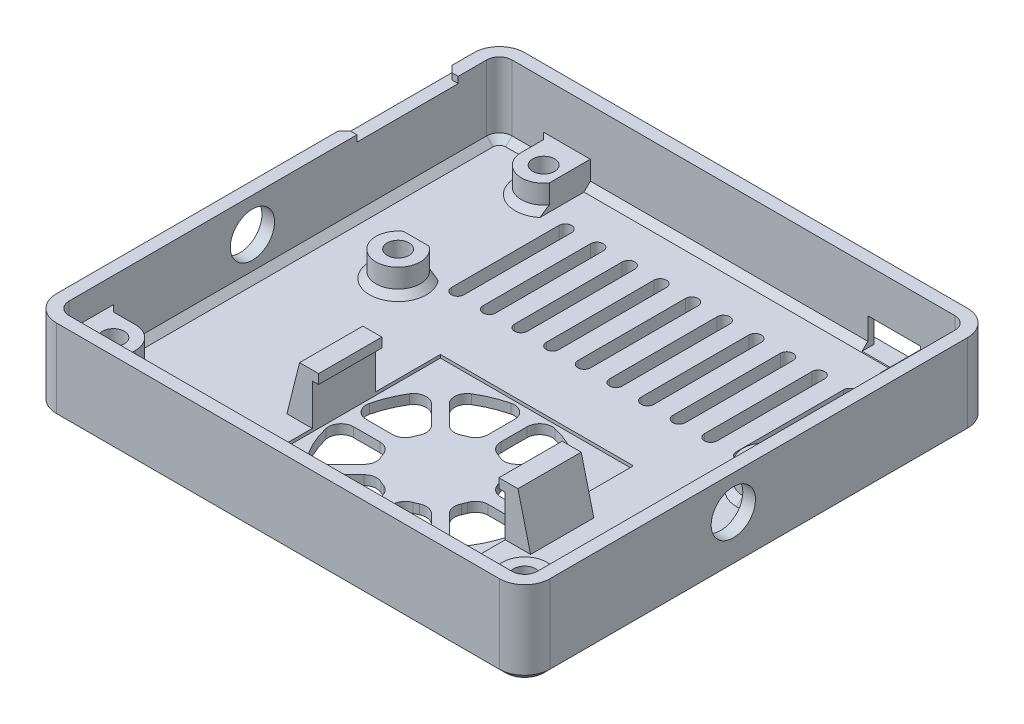
from build123d import *

# Parameters (mm, degrees)
BOSS_EXTRUDE1_DEPTH                               = 13.4
BOSS_EXTRUDE2_DEPTH                               = 2
BOSS_EXTRUDE3_DEPTH                               = 4
CSK_FOR_4_FLAT_HEAD_SOCKET_CAP_SCREW1_D           = 3.4544
CSK_FOR_4_FLAT_HEAD_SOCKET_CAP_SCREW1_CSINK_D     = 6.7237102
CSK_FOR_4_FLAT_HEAD_SOCKET_CAP_SCREW1_CSINK_ANGLE = 82
CUT_EXTRUDE1_REACH                                = 108.647
SKETCH7_W                                         = 8.3
SKETCH7_H                                         = 4.4
BOSS_EXTRUDE4_DEPTH                               = 7.4
CSK_FOR_4_FLAT_HEAD_SOCKET_CAP_SCREW2_D           = 3.4544
CSK_FOR_4_FLAT_HEAD_SOCKET_CAP_SCREW2_CSINK_D     = 6.7237102
CSK_FOR_4_FLAT_HEAD_SOCKET_CAP_SCREW2_CSINK_ANGLE = 82
CHAMFER1_SIZE                                     = 1
CHAMFER2_SIZE                                     = 1
CHAMFER3_SIZE                                     = 1
CHAMFER4_SIZE                                     = 1
CUT_EXTRUDE2_REACH                                = 97.86
SKETCH13_W                                        = 30.5
SKETCH13_H                                        = 30.5
CUT_EXTRUDE3_DEPTH                                = 0.5
SKETCH14_W                                        = 2
SKETCH14_H                                        = 10
BOSS_EXTRUDE5_DEPTH                               = 8
SKETCH15_W                                        = 10
SKETCH15_H                                        = 1.5
BOSS_EXTRUDE6_DEPTH                               = 1
SKETCH16_W                                        = 10
SKETCH16_H                                        = 1.5
BOSS_EXTRUDE7_DEPTH                               = 1
CHAMFER5_SIZE                                     = 2
CHAMFER5_SIZE_2                                   = 8.021561867
CUT_EXTRUDE4_DEPTH                                = 96.661387058
CUT_EXTRUDE5_DEPTH                                = 97.161962556
CUT_EXTRUDE5_DEPTH_BACK                           = 97.161962556
SKETCH18_R                                        = 3.5
CUT_EXTRUDE6_REACH                                = 99.75
SKETCH19_W                                        = 16
SKETCH19_H                                        = 1
CHAMFER6_SIZE                                     = 1


with BuildPart() as part:
    # Sketch2 → Boss-Extrude1 (new body)
    with BuildSketch(Plane(origin=(0, 0, 0), x_dir=(1, 0, 0), z_dir=(0, 1, 0))):
        with BuildLine():
            Line((-75.616981764, 12.627854819), (-75.616981764, -53.372145181))
            ThreePointArc((-75.616981764, -53.372145181), (-74.445408889, -56.200572306), (-71.616981764, -57.372145181))
            Line((-71.616981764, -57.372145181), (-1.616981764, -57.372145181))
            ThreePointArc((-1.616981764, -57.372145181), (1.211445361, -56.200572306), (2.383018236, -53.372145181))
            Line((2.383018236, -53.372145181), (2.383018236, 12.627854819))
            ThreePointArc((2.383018236, 12.627854819), (1.211445361, 15.456281944), (-1.616981764, 16.627854819))
            Line((-1.616981764, 16.627854819), (-71.616981764, 16.627854819))
            ThreePointArc((-71.616981764, 16.627854819), (-74.445408889, 15.456281944), (-75.616981764, 12.627854819))
        make_face()
        with BuildLine():
            Line((-73.616981764, 12.627854819), (-73.616981764, -53.372145181))
            ThreePointArc((-73.616981764, -53.372145181), (-73.031195326, -54.786358744), (-71.616981764, -55.372145181))
            Line((-71.616981764, -55.372145181), (-1.616981764, -55.372145181))
            ThreePointArc((-1.616981764, -55.372145181), (-0.202768202, -54.786358744), (0.383018236, -53.372145181))
            Line((0.383018236, -53.372145181), (0.383018236, 12.627854819))
            ThreePointArc((0.383018236, 12.627854819), (-0.202768202, 14.042068381), (-1.616981764, 14.627854819))
            Line((-1.616981764, 14.627854819), (-71.616981764, 14.627854819))
            ThreePointArc((-71.616981764, 14.627854819), (-73.031195326, 14.042068381), (-73.616981764, 12.627854819))
        make_face(mode=Mode.SUBTRACT)
    extrude(amount=BOSS_EXTRUDE1_DEPTH)

    # Sketch2<3> → Boss-Extrude2 (add)
    with BuildSketch(Plane(origin=(0, 0, 0), x_dir=(1, 0, 0), z_dir=(0, 1, 0))):
        with BuildLine():
            Line((-71.616981764, 14.627854819), (-1.616981764, 14.627854819))
            ThreePointArc((-1.616981764, 14.627854819), (-0.202768202, 14.042068381), (0.383018236, 12.627854819))
            Line((0.383018236, 12.627854819), (0.383018236, -53.372145181))
            ThreePointArc((0.383018236, -53.372145181), (-0.202768202, -54.786358744), (-1.616981764, -55.372145181))
            Line((-1.616981764, -55.372145181), (-71.616981764, -55.372145181))
            ThreePointArc((-71.616981764, -55.372145181), (-73.031195326, -54.786358744), (-73.616981764, -53.372145181))
            Line((-73.616981764, -53.372145181), (-73.616981764, 12.627854819))
            ThreePointArc((-73.616981764, 12.627854819), (-73.031195326, 14.042068381), (-71.616981764, 14.627854819))
        make_face()
    extrude(amount=BOSS_EXTRUDE2_DEPTH)

    # Sketch4 → Boss-Extrude3 (add)
    with BuildSketch(Plane(origin=(0, 2, 0), x_dir=(1, 0, 0), z_dir=(0, 1, 0))):
        with BuildLine():
            Line((-59.234341769, 14.627854819), (-59.234341769, 8.142814098))
            ThreePointArc((-59.234341769, 8.142814098), (-63.156395065, 6.785756677), (-65.616981764, 10.127854819))
            Line((-65.616981764, 10.127854819), (-65.616981764, 14.627854819))
            Line((-65.616981764, 14.627854819), (-59.234341769, 14.627854819))
        make_face()
        with BuildLine():
            Line((-4.116981764, 6.627854819), (0.383018236, 6.627854819))
            Line((0.383018236, 6.627854819), (0.383018236, 12.627854819))
            ThreePointArc((0.383018236, 12.627854819), (-0.202768202, 14.042068381), (-1.616981764, 14.627854819))
            Line((-1.616981764, 14.627854819), (-7.082532008, 14.627854819))
            Line((-7.082532008, 14.627854819), (-7.082532008, 8.268954136))
            ThreePointArc((-7.082532008, 8.268954136), (-5.811656897, 7.065490341), (-4.116981764, 6.627854819))
        make_face()
        with BuildLine():
            Line((-4.116981764, -9.372145181), (0.383018236, -9.372145181))
            Line((0.383018236, -9.372145181), (0.383018236, -16.372145181))
            Line((0.383018236, -16.372145181), (-4.116981764, -16.372145181))
            ThreePointArc((-4.116981764, -16.372145181), (-7.616981764, -12.872145181), (-4.116981764, -9.372145181))
        make_face()
        with BuildLine():
            Line((-64.139653984, -10.015784368), (-60.094309544, -10.015784368))
            ThreePointArc((-60.094309544, -10.015784368), (-62.116981764, -16.372145181), (-64.139653984, -10.015784368))
        make_face()
    extrude(amount=BOSS_EXTRUDE3_DEPTH)

    # CSK for #4 Flat Head Socket Cap Screw1 (through all)
    with Locations(Plane(origin=(0, 0, 0), x_dir=(-1, 0, 0), z_dir=(0, -1, 0))):
        with Locations((4.116981764, 10.127854819), (62.116981764, 10.127854819), (4.116981764, -12.872145181), (62.116981764, -12.872145181)):
            CounterSinkHole(CSK_FOR_4_FLAT_HEAD_SOCKET_CAP_SCREW1_D / 2, CSK_FOR_4_FLAT_HEAD_SOCKET_CAP_SCREW1_CSINK_D / 2, counter_sink_angle=CSK_FOR_4_FLAT_HEAD_SOCKET_CAP_SCREW1_CSINK_ANGLE)

    # Sketch7 → Cut-Extrude1 (cut, up to next)
    with BuildSketch(Plane(origin=(0, 0, -16.627854819), x_dir=(-1, 0, 0), z_dir=(0, 0, -1)), mode=Mode.PRIVATE) as cut_extrude1_sk1:
        with Locations((11.232532008, 4.3)):
            Rectangle(SKETCH7_W, SKETCH7_H)
    cut_extrude1_tool1 = extrude(cut_extrude1_sk1.sketch, amount=-CUT_EXTRUDE1_REACH, mode=Mode.PRIVATE) & part.part
    add(cut_extrude1_tool1.solids().sort_by_distance((-11.232532, 4.3, -16.627855))[0], mode=Mode.SUBTRACT)

    # Sketch9 → Boss-Extrude4 (add)
    with BuildSketch(Plane(origin=(0, 2, 0), x_dir=(1, 0, 0), z_dir=(0, 1, 0))):
        with BuildLine():
            Line((-69.116981764, -47.372145181), (-73.616981764, -47.372145181))
            Line((-73.616981764, -47.372145181), (-73.616981764, -53.372145181))
            ThreePointArc((-73.616981764, -53.372145181), (-73.031195326, -54.786358744), (-71.616981764, -55.372145181))
            Line((-71.616981764, -55.372145181), (-65.616981764, -55.372145181))
            Line((-65.616981764, -55.372145181), (-65.616981764, -50.872145181))
            ThreePointArc((-65.616981764, -50.872145181), (-66.64210803, -48.397271447), (-69.116981764, -47.372145181))
        make_face()
        with BuildLine():
            Line((-4.116981764, -47.372145181), (0.383018236, -47.372145181))
            Line((0.383018236, -47.372145181), (0.383018236, -53.372145181))
            ThreePointArc((0.383018236, -53.372145181), (-0.202768202, -54.786358744), (-1.616981764, -55.372145181))
            Line((-1.616981764, -55.372145181), (-7.616981764, -55.372145181))
            Line((-7.616981764, -55.372145181), (-7.616981764, -50.872145181))
            ThreePointArc((-7.616981764, -50.872145181), (-6.591855498, -48.397271447), (-4.116981764, -47.372145181))
        make_face()
    extrude(amount=BOSS_EXTRUDE4_DEPTH)

    # CSK for #4 Flat Head Socket Cap Screw2 (through all)
    with Locations(Plane(origin=(0, 0, 0), x_dir=(-1, 0, 0), z_dir=(0, -1, 0))):
        with Locations((4.116981764, -50.872145181), (69.116981764, -50.872145181)):
            CounterSinkHole(CSK_FOR_4_FLAT_HEAD_SOCKET_CAP_SCREW2_D / 2, CSK_FOR_4_FLAT_HEAD_SOCKET_CAP_SCREW2_CSINK_D / 2, counter_sink_angle=CSK_FOR_4_FLAT_HEAD_SOCKET_CAP_SCREW2_CSINK_ANGLE)

    # Chamfer1
    chamfer1_edges = [part.edges().sort_by_distance(p)[0] for p in [
        (0.383018236, 4, -6.627854819),
        (-65.616981764, 4, -14.627854819),
        (0.383018236, 5.7, 47.372145181),
        (-7.616981764, 5.7, 55.372145181),
        (-73.616981764, 5.7, 47.372145181),
        (-65.616981764, 5.7, 55.372145181),
        (0.383018236, 4, 16.372145181),
        (0.383018236, 4, 9.372145181),
    ]]
    chamfer(chamfer1_edges, length=CHAMFER1_SIZE)

    # Chamfer2
    # the kernel refuses this chamfer: 1 mm, written as the material it adds along each edge
    with BuildSketch(Plane(origin=(-62.116981764, 2, 12.872145181), x_dir=(0.003141587485879022, 0, -0.9999950652018582), z_dir=(-0.9999950652018582, 0, -0.003141587485879022))) as chamfer2_piece_1_section:
        Polygon((3.5, -CHAMFER2_SIZE), (3.5 + CHAMFER2_SIZE, 0), (3.5, 0), align=None)
    chamfer2_piece_1 = revolve(axis=Axis((-62.116981764, 2, 12.872145181), (0, -1, 0)), revolution_arc=359.64, mode=Mode.PRIVATE)
    chamfer2_piece_1 = split(chamfer2_piece_1, bisect_by=Plane(origin=(-62.116981764, 2.485154512, 10.015784368), z_dir=(0, 0, 1)), keep=Keep.TOP, mode=Mode.PRIVATE)
    add(chamfer2_piece_1)
    with BuildSketch(Plane(origin=(-65.616981764, 2, -10.127854819), x_dir=(0.02749587661058217, 0.9996219169112968, 0), z_dir=(0, 0, -1)), Plane(origin=(-4.116981764, 2, 9.372145181), x_dir=(0, 0.9996219169112968, 0.027495876610585623), z_dir=(1, 0, 0)), Plane(origin=(1.954701224, 2, 16.372145181), x_dir=(0, 0.9996219169112968, -0.027495876610585623), z_dir=(-1, 0, 0)), Plane(origin=(-4.116981764, 2, 47.372145181), x_dir=(0, 0.9996219169112968, 0.027495876610589075), z_dir=(1, 0, 0)), Plane(origin=(-7.616981764, 2, 56.943828169), x_dir=(0.027495876610586487, 0.9996219169112968, 0), z_dir=(0, 0, -1))) as chamfer2_piece_2:
        Polygon((CHAMFER2_SIZE * 0.999621916911, -CHAMFER2_SIZE * 0.0274958766106), (-CHAMFER2_SIZE * 0.0274958766106, -CHAMFER2_SIZE * 0.999621916911), (0, 0), align=None)
    extrude(amount=6.071682988)
    with BuildSketch(Plane(origin=(-62.116981764, 2, -10.127854819), x_dir=(0.991235900196607, 0, -0.13210370987001793), z_dir=(-0.13210370987001793, 0, -0.991235900196607))) as chamfer2_piece_3_section:
        Polygon((3.5, -CHAMFER2_SIZE), (3.5 + CHAMFER2_SIZE, 0), (3.5, 0), align=None)
    chamfer2_piece_3 = revolve(axis=Axis((-62.116981764, 2, -10.127854819), (0, -1, 0)), revolution_arc=187.591174622, mode=Mode.PRIVATE)
    chamfer2_piece_3 = split(chamfer2_piece_3, bisect_by=Plane(origin=(-59.234341769, 2.488876312, -6.31893593), z_dir=(-1, 0, 0)), keep=Keep.TOP, mode=Mode.PRIVATE)
    add(chamfer2_piece_3)
    with BuildSketch(Plane(origin=(-4.116981764, 2, -6.627854819), x_dir=(0, 0.9996219169112968, -0.027495876610586487), z_dir=(1, 0, 0)), Plane(origin=(-65.616981764, 2, 56.943828169), x_dir=(-0.02749587661058217, 0.9996219169112968, 0), z_dir=(0, 0, -1)), Plane(origin=(-69.116981764, 2, 47.372145181), x_dir=(0, 0.9996219169112968, 0.027495876610589075), z_dir=(-1, 0, 0))) as chamfer2_piece_4:
        Polygon((CHAMFER2_SIZE * 0.999621916911, CHAMFER2_SIZE * 0.0274958766106), (-CHAMFER2_SIZE * 0.0274958766106, CHAMFER2_SIZE * 0.999621916911), (0, 0), align=None)
    extrude(amount=6.071682988)
    with BuildSketch(Plane(origin=(-4.116981764, 2, -10.127854819), x_dir=(-0.984731163899138, 0, -0.17408197737229716), z_dir=(0.17408197737229716, 0, -0.984731163899138))) as chamfer2_piece_5_section:
        Polygon((3.5, CHAMFER2_SIZE), (3.5 + CHAMFER2_SIZE, 0), (3.5, 0), align=None)
    chamfer2_piece_5 = revolve(axis=Axis((-4.116981764, 2, -10.127854819), (0, 1, 0)), revolution_arc=100.0252393, mode=Mode.PRIVATE)
    chamfer2_piece_5 = split(chamfer2_piece_5, bisect_by=Plane(origin=(-7.082532008, 2.379155604, -7.145485846), z_dir=(1, 0, 0)), keep=Keep.TOP, mode=Mode.PRIVATE)
    add(chamfer2_piece_5)
    with BuildSketch(Plane(origin=(0.383018236, 2, -8.199537807), x_dir=(0.02749587661058643, 0.9996219169112968, 0), z_dir=(0, 0, 1))) as chamfer2_piece_6:
        Polygon((CHAMFER2_SIZE * 0.999621916911, CHAMFER2_SIZE * 0.0274958766106), (-CHAMFER2_SIZE * 0.0274958766106, CHAMFER2_SIZE * 0.999621916911), (0, 0), align=None)
    extrude(amount=19.143365976)
    with BuildSketch(Plane(origin=(-4.116981764, 2, 12.872145181), x_dir=(0, 0, 1), z_dir=(1, 0, 0))) as chamfer2_piece_7:
        Polygon((3.5, -CHAMFER2_SIZE), (3.5 + CHAMFER2_SIZE, 0), (3.5, 0), align=None)
    revolve(axis=Axis((-4.116981764, 2, 12.872145181), (0, -1, 0)), revolution_arc=180)
    with BuildSketch(Plane(origin=(0.383018236, 2, 14.800462193), x_dir=(0.02749587661058638, 0.9996219169112968, 0), z_dir=(0, 0, 1))) as chamfer2_piece_8:
        Polygon((CHAMFER2_SIZE * 0.999621916911, CHAMFER2_SIZE * 0.0274958766106), (-CHAMFER2_SIZE * 0.0274958766106, CHAMFER2_SIZE * 0.999621916911), (0, 0), align=None)
    extrude(amount=34.143365976)
    with BuildSketch(Plane(origin=(-4.116981764, 2, 50.872145181), x_dir=(-1, 0, 0), z_dir=(0, 0, 1))) as chamfer2_piece_9:
        Polygon((3.5, -CHAMFER2_SIZE), (3.5 + CHAMFER2_SIZE, 0), (3.5, 0), align=None)
    revolve(axis=Axis((-4.116981764, 2, 50.872145181), (0, -1, 0)), revolution_arc=90)
    with BuildSketch(Plane(origin=(-6.045298776, 2, 55.372145181), x_dir=(0, 0.9996219169112968, 0.027495876610589075), z_dir=(-1, 0, 0))) as chamfer2_piece_10:
        Polygon((CHAMFER2_SIZE * 0.999621916911, CHAMFER2_SIZE * 0.0274958766106), (-CHAMFER2_SIZE * 0.0274958766106, CHAMFER2_SIZE * 0.999621916911), (0, 0), align=None)
    extrude(amount=61.143365976)
    with BuildSketch(Plane(origin=(-69.116981764, 2, 50.872145181), x_dir=(1, 0, 0), z_dir=(0, 0, 1))) as chamfer2_piece_11:
        Polygon((3.5, CHAMFER2_SIZE), (3.5 + CHAMFER2_SIZE, 0), (3.5, 0), align=None)
    revolve(axis=Axis((-69.116981764, 2, 50.872145181), (0, 1, 0)), revolution_arc=90)
    with BuildSketch(Plane(origin=(-71.616981764, 2, -14.627854819), x_dir=(0, 0.9996219169112968, -0.027495876610585623), z_dir=(1, 0, 0))) as chamfer2_piece_12:
        Polygon((CHAMFER2_SIZE * 0.999621916911, CHAMFER2_SIZE * 0.0274958766106), (-CHAMFER2_SIZE * 0.0274958766106, CHAMFER2_SIZE * 0.999621916911), (0, 0), align=None)
    extrude(amount=7.571682988)
    with BuildSketch(Plane(origin=(-71.616981764, 2, -12.627854819), x_dir=(-1, 0, 0), z_dir=(0, 0, 1))) as chamfer2_piece_13:
        Polygon((2, -CHAMFER2_SIZE), (2 - CHAMFER2_SIZE, 0), (2, 0), align=None)
    revolve(axis=Axis((-71.616981764, 2, -12.627854819), (0, -1, 0)), revolution_arc=90)
    with BuildSketch(Plane(origin=(-73.616981764, 2, 48.943828169), x_dir=(-0.02749587661058217, 0.9996219169112968, 0), z_dir=(0, 0, -1))) as chamfer2_piece_14:
        Polygon((CHAMFER2_SIZE * 0.999621916911, CHAMFER2_SIZE * 0.0274958766106), (-CHAMFER2_SIZE * 0.0274958766106, CHAMFER2_SIZE * 0.999621916911), (0, 0), align=None)
    extrude(amount=61.571682988)
    with BuildSketch(Plane(origin=(-61.806024757, 2, -14.627854819), x_dir=(0, 0.9996219169112968, -0.027495876610585623), z_dir=(1, 0, 0))) as chamfer2_piece_15_section:
        Polygon((CHAMFER2_SIZE * 0.999621916911, CHAMFER2_SIZE * 0.0274958766106), (-CHAMFER2_SIZE * 0.0274958766106, CHAMFER2_SIZE * 0.999621916911), (0, 0), align=None)
    chamfer2_piece_15 = extrude(amount=57.295175737, mode=Mode.PRIVATE)
    chamfer2_piece_15 = split(chamfer2_piece_15, bisect_by=Plane(origin=(-15.382532008, 2.4, -14.327854819), z_dir=(-1, 0, 0)), keep=Keep.TOP, mode=Mode.PRIVATE)
    add(chamfer2_piece_15)
    with BuildSketch(Plane(origin=(-61.806024757, 2, -14.627854819), x_dir=(0, 0.9996219169112968, -0.027495876610585623), z_dir=(1, 0, 0))) as chamfer2_piece_16_section:
        Polygon((CHAMFER2_SIZE * 0.999621916911, CHAMFER2_SIZE * 0.0274958766106), (-CHAMFER2_SIZE * 0.0274958766106, CHAMFER2_SIZE * 0.999621916911), (0, 0), align=None)
    chamfer2_piece_16 = extrude(amount=57.295175737, mode=Mode.PRIVATE)
    chamfer2_piece_16 = split(chamfer2_piece_16, bisect_by=Plane(origin=(-11.232532008, 2.1, -14.152416222), z_dir=(0, -1, 0)), keep=Keep.TOP, mode=Mode.PRIVATE)
    add(chamfer2_piece_16)

    # Chamfer3
    chamfer3_edges = [part.edges().sort_by_distance(p)[0] for p in [
        (-75.616981764, 0, 20.372145181),
        (-74.445408889, 0, -15.456281944),
        (-36.616981764, 0, -16.627854819),
        (1.211445361, 0, -15.456281944),
        (2.383018236, 0, 20.372145181),
        (1.211445361, 0, 56.200572306),
        (-36.616981764, 0, 57.372145181),
        (-74.445408889, 0, 56.200572306),
    ]]
    chamfer(chamfer3_edges, length=CHAMFER3_SIZE)

    # Chamfer4
    chamfer4_edges = [part.edges().sort_by_distance(p)[0] for p in [
        (-7.082532008, 4.3, -16.627854819),
        (-15.382532008, 4.3, -16.627854819),
    ]]
    chamfer(chamfer4_edges, length=CHAMFER4_SIZE)

    # Sketch12 → Cut-Extrude2 (cut, up to next)
    with BuildSketch(Plane.XZ, mode=Mode.PRIVATE) as cut_extrude2_sk1:
        with BuildLine():
            Line((-54.660539895, 9.911346827), (-54.660539895, -7.088653173))
            ThreePointArc((-54.660539895, -7.088653173), (-55.660539895, -8.088653173), (-56.660539895, -7.088653173))
            Line((-56.660539895, -7.088653173), (-56.660539895, 9.911346827))
            ThreePointArc((-56.660539895, 9.911346827), (-55.660539895, 10.911346827), (-54.660539895, 9.911346827))
        make_face()
    cut_extrude2_tool1 = extrude(cut_extrude2_sk1.sketch, amount=-CUT_EXTRUDE2_REACH, mode=Mode.PRIVATE) & part.part
    # Sketch12 → Cut-Extrude2 (cut, up to next)
    with BuildSketch(Plane.XZ, mode=Mode.PRIVATE) as cut_extrude2_sk2:
        with BuildLine():
            Line((-49.660539895, 9.911346827), (-49.660539895, -7.088653173))
            ThreePointArc((-49.660539895, -7.088653173), (-50.660539895, -8.088653173), (-51.660539895, -7.088653173))
            Line((-51.660539895, -7.088653173), (-51.660539895, 9.911346827))
            ThreePointArc((-51.660539895, 9.911346827), (-50.660539895, 10.911346827), (-49.660539895, 9.911346827))
        make_face()
    cut_extrude2_tool2 = extrude(cut_extrude2_sk2.sketch, amount=-CUT_EXTRUDE2_REACH, mode=Mode.PRIVATE) & part.part
    # Sketch12 → Cut-Extrude2 (cut, up to next)
    with BuildSketch(Plane.XZ, mode=Mode.PRIVATE) as cut_extrude2_sk3:
        with BuildLine():
            Line((-44.660539895, 9.911346827), (-44.660539895, -7.088653173))
            ThreePointArc((-44.660539895, -7.088653173), (-45.660539895, -8.088653173), (-46.660539895, -7.088653173))
            Line((-46.660539895, -7.088653173), (-46.660539895, 9.911346827))
            ThreePointArc((-46.660539895, 9.911346827), (-45.660539895, 10.911346827), (-44.660539895, 9.911346827))
        make_face()
    cut_extrude2_tool3 = extrude(cut_extrude2_sk3.sketch, amount=-CUT_EXTRUDE2_REACH, mode=Mode.PRIVATE) & part.part
    # Sketch12 → Cut-Extrude2 (cut, up to next)
    with BuildSketch(Plane.XZ, mode=Mode.PRIVATE) as cut_extrude2_sk4:
        with BuildLine():
            Line((-39.660539895, 9.911346827), (-39.660539895, -7.088653173))
            ThreePointArc((-39.660539895, -7.088653173), (-40.660539895, -8.088653173), (-41.660539895, -7.088653173))
            Line((-41.660539895, -7.088653173), (-41.660539895, 9.911346827))
            ThreePointArc((-41.660539895, 9.911346827), (-40.660539895, 10.911346827), (-39.660539895, 9.911346827))
        make_face()
    cut_extrude2_tool4 = extrude(cut_extrude2_sk4.sketch, amount=-CUT_EXTRUDE2_REACH, mode=Mode.PRIVATE) & part.part
    # Sketch12 → Cut-Extrude2 (cut, up to next)
    with BuildSketch(Plane.XZ, mode=Mode.PRIVATE) as cut_extrude2_sk5:
        with BuildLine():
            Line((-34.660539895, 9.911346827), (-34.660539895, -7.088653173))
            ThreePointArc((-34.660539895, -7.088653173), (-35.660539895, -8.088653173), (-36.660539895, -7.088653173))
            Line((-36.660539895, -7.088653173), (-36.660539895, 9.911346827))
            ThreePointArc((-36.660539895, 9.911346827), (-35.660539895, 10.911346827), (-34.660539895, 9.911346827))
        make_face()
    cut_extrude2_tool5 = extrude(cut_extrude2_sk5.sketch, amount=-CUT_EXTRUDE2_REACH, mode=Mode.PRIVATE) & part.part
    # Sketch12 → Cut-Extrude2 (cut, up to next)
    with BuildSketch(Plane.XZ, mode=Mode.PRIVATE) as cut_extrude2_sk6:
        with BuildLine():
            Line((-29.660539895, 9.911346827), (-29.660539895, -7.088653173))
            ThreePointArc((-29.660539895, -7.088653173), (-30.660539895, -8.088653173), (-31.660539895, -7.088653173))
            Line((-31.660539895, -7.088653173), (-31.660539895, 9.911346827))
            ThreePointArc((-31.660539895, 9.911346827), (-30.660539895, 10.911346827), (-29.660539895, 9.911346827))
        make_face()
    cut_extrude2_tool6 = extrude(cut_extrude2_sk6.sketch, amount=-CUT_EXTRUDE2_REACH, mode=Mode.PRIVATE) & part.part
    # Sketch12 → Cut-Extrude2 (cut, up to next)
    with BuildSketch(Plane.XZ, mode=Mode.PRIVATE) as cut_extrude2_sk7:
        with BuildLine():
            Line((-24.660539895, 9.911346827), (-24.660539895, -7.088653173))
            ThreePointArc((-24.660539895, -7.088653173), (-25.660539895, -8.088653173), (-26.660539895, -7.088653173))
            Line((-26.660539895, -7.088653173), (-26.660539895, 9.911346827))
            ThreePointArc((-26.660539895, 9.911346827), (-25.660539895, 10.911346827), (-24.660539895, 9.911346827))
        make_face()
    cut_extrude2_tool7 = extrude(cut_extrude2_sk7.sketch, amount=-CUT_EXTRUDE2_REACH, mode=Mode.PRIVATE) & part.part
    # Sketch12 → Cut-Extrude2 (cut, up to next)
    with BuildSketch(Plane.XZ, mode=Mode.PRIVATE) as cut_extrude2_sk8:
        with BuildLine():
            Line((-19.660539895, 9.911346827), (-19.660539895, -7.088653173))
            ThreePointArc((-19.660539895, -7.088653173), (-20.660539895, -8.088653173), (-21.660539895, -7.088653173))
            Line((-21.660539895, -7.088653173), (-21.660539895, 9.911346827))
            ThreePointArc((-21.660539895, 9.911346827), (-20.660539895, 10.911346827), (-19.660539895, 9.911346827))
        make_face()
    cut_extrude2_tool8 = extrude(cut_extrude2_sk8.sketch, amount=-CUT_EXTRUDE2_REACH, mode=Mode.PRIVATE) & part.part
    # Sketch12 → Cut-Extrude2 (cut, up to next)
    with BuildSketch(Plane.XZ, mode=Mode.PRIVATE) as cut_extrude2_sk9:
        with BuildLine():
            Line((-14.660539895, 9.911346827), (-14.660539895, -7.088653173))
            ThreePointArc((-14.660539895, -7.088653173), (-15.660539895, -8.088653173), (-16.660539895, -7.088653173))
            Line((-16.660539895, -7.088653173), (-16.660539895, 9.911346827))
            ThreePointArc((-16.660539895, 9.911346827), (-15.660539895, 10.911346827), (-14.660539895, 9.911346827))
        make_face()
    cut_extrude2_tool9 = extrude(cut_extrude2_sk9.sketch, amount=-CUT_EXTRUDE2_REACH, mode=Mode.PRIVATE) & part.part
    # Sketch12 → Cut-Extrude2 (cut, up to next)
    with BuildSketch(Plane.XZ, mode=Mode.PRIVATE) as cut_extrude2_sk10:
        with BuildLine():
            Line((-9.660539895, 9.911346827), (-9.660539895, -7.088653173))
            ThreePointArc((-9.660539895, -7.088653173), (-10.660539895, -8.088653173), (-11.660539895, -7.088653173))
            Line((-11.660539895, -7.088653173), (-11.660539895, 9.911346827))
            ThreePointArc((-11.660539895, 9.911346827), (-10.660539895, 10.911346827), (-9.660539895, 9.911346827))
        make_face()
    cut_extrude2_tool10 = extrude(cut_extrude2_sk10.sketch, amount=-CUT_EXTRUDE2_REACH, mode=Mode.PRIVATE) & part.part
    add(cut_extrude2_tool1.solids().sort_by_distance((-55.66054, 0, 1.411347))[0], mode=Mode.SUBTRACT)
    add(cut_extrude2_tool2.solids().sort_by_distance((-50.66054, 0, 1.411347))[0], mode=Mode.SUBTRACT)
    add(cut_extrude2_tool3.solids().sort_by_distance((-45.66054, 0, 1.411347))[0], mode=Mode.SUBTRACT)
    add(cut_extrude2_tool4.solids().sort_by_distance((-40.66054, 0, 1.411347))[0], mode=Mode.SUBTRACT)
    add(cut_extrude2_tool5.solids().sort_by_distance((-35.66054, 0, 1.411347))[0], mode=Mode.SUBTRACT)
    add(cut_extrude2_tool6.solids().sort_by_distance((-30.66054, 0, 1.411347))[0], mode=Mode.SUBTRACT)
    add(cut_extrude2_tool7.solids().sort_by_distance((-25.66054, 0, 1.411347))[0], mode=Mode.SUBTRACT)
    add(cut_extrude2_tool8.solids().sort_by_distance((-20.66054, 0, 1.411347))[0], mode=Mode.SUBTRACT)
    add(cut_extrude2_tool9.solids().sort_by_distance((-15.66054, 0, 1.411347))[0], mode=Mode.SUBTRACT)
    add(cut_extrude2_tool10.solids().sort_by_distance((-10.66054, 0, 1.411347))[0], mode=Mode.SUBTRACT)

    # Sketch13 → Cut-Extrude3 (cut)
    with BuildSketch(Plane(origin=(0, 2, 0), x_dir=(1, 0, 0), z_dir=(0, 1, 0))):
        with Locations((-33.116981764, -35.190207042)):
            Rectangle(SKETCH13_W, SKETCH13_H)
    extrude(amount=-CUT_EXTRUDE3_DEPTH, mode=Mode.SUBTRACT)

    # Sketch14 → Boss-Extrude5 (add)
    with BuildSketch(Plane(origin=(0, 2, 0), x_dir=(1, 0, 0), z_dir=(0, 1, 0))):
        with Locations((-49.366981764, -35.190207042)):
            Rectangle(SKETCH14_W, SKETCH14_H)
        with Locations((-16.866981764, -35.190207042)):
            Rectangle(SKETCH14_W, SKETCH14_H)
    extrude(amount=BOSS_EXTRUDE5_DEPTH)

    # Sketch15 → Boss-Extrude6 (add)
    with BuildSketch(Plane.ZY.offset(17.866981764)):
        with Locations((35.190207042, 9.25)):
            Rectangle(SKETCH15_W, SKETCH15_H)
    extrude(amount=BOSS_EXTRUDE6_DEPTH)

    # Sketch16 → Boss-Extrude7 (add)
    with BuildSketch(Plane(origin=(-48.366981764, 0, 0), x_dir=(0, 0, -1), z_dir=(1, 0, 0))):
        with Locations((-35.190207042, 9.25)):
            Rectangle(SKETCH16_W, SKETCH16_H)
    extrude(amount=BOSS_EXTRUDE7_DEPTH)

    # Chamfer5
    # the kernel refuses this chamfer: 8.021561867, 2 mm, written as the material it adds along each edge
    with BuildSketch(Plane(origin=(-50.366981764, 2, 40.190207042), x_dir=(-0.9889581332499592, -0.14819517765013834, 0), z_dir=(0, 0, -1))) as chamfer5_piece_1_section:
        Polygon((CHAMFER5_SIZE * 0.98895813325, CHAMFER5_SIZE * 0.14819517765), (-CHAMFER5_SIZE_2 * 0.148195177651, CHAMFER5_SIZE_2 * 0.988958133259), (0, 0), align=None)
    chamfer5_piece_1 = extrude(amount=10, mode=Mode.PRIVATE)
    chamfer5_piece_1 = split(chamfer5_piece_1, bisect_by=Plane(origin=(-51.896020518, 10, 35.190207042), z_dir=(0, -1, 0)), keep=Keep.TOP, mode=Mode.PRIVATE)
    add(chamfer5_piece_1)
    with BuildSketch(Plane(origin=(-15.866981764, 2, 30.190207042), x_dir=(0.9889581332499592, -0.14819517765013798, 0), z_dir=(0, 0, 1))) as chamfer5_piece_2_section:
        Polygon((CHAMFER5_SIZE * 0.98895813325, CHAMFER5_SIZE * 0.14819517765), (-CHAMFER5_SIZE_2 * 0.148195177651, CHAMFER5_SIZE_2 * 0.988958133259), (0, 0), align=None)
    chamfer5_piece_2 = extrude(amount=10, mode=Mode.PRIVATE)
    chamfer5_piece_2 = split(chamfer5_piece_2, bisect_by=Plane(origin=(-14.396020518, 10, 35.190207042), z_dir=(0, -1, 0)), keep=Keep.TOP, mode=Mode.PRIVATE)
    add(chamfer5_piece_2)

    # Sketch17 → Cut-Extrude4 (cut, through all)
    with BuildSketch(Plane(origin=(0, 1.5, 0), x_dir=(1, 0, 0), z_dir=(0, 1, 0))):
        with BuildLine():
            Line((-41.396104278, -25.496870966), (-38.453164464, -28.43981078))
            ThreePointArc((-38.453164464, -28.43981078), (-37.374934115, -28.997174069), (-36.172958249, -28.828388588))
            ThreePointArc((-36.172958249, -28.828388588), (-35.817862811, -28.669703389), (-35.454565038, -28.530820377))
            ThreePointArc((-35.454565038, -28.530820377), (-34.485290394, -27.800244449), (-34.116981764, -26.643705097))
            Line((-34.116981764, -26.643705097), (-34.116981764, -22.481759699))
            ThreePointArc((-34.116981764, -22.481759699), (-34.875811955, -20.913481183), (-36.576479269, -20.535259752))
            ThreePointArc((-36.576479269, -20.535259752), (-38.87933027, -21.278667129), (-41.033360226, -22.381360291))
            ThreePointArc((-41.033360226, -22.381360291), (-41.968470678, -23.851356619), (-41.396104278, -25.496870966))
        make_face()
        with BuildLine():
            Line((-32.116981764, -22.481759699), (-32.116981764, -26.643705097))
            ThreePointArc((-32.116981764, -26.643705097), (-31.748673134, -27.800244449), (-30.77939849, -28.530820377))
            ThreePointArc((-30.77939849, -28.530820377), (-30.416100717, -28.669703389), (-30.061005279, -28.828388588))
            ThreePointArc((-30.061005279, -28.828388588), (-28.859029413, -28.997174069), (-27.780799064, -28.43981078))
            Line((-27.780799064, -28.43981078), (-24.83785925, -25.496870966))
            ThreePointArc((-24.83785925, -25.496870966), (-24.26549285, -23.851356619), (-25.200603302, -22.381360291))
            ThreePointArc((-25.200603302, -22.381360291), (-27.354633258, -21.278667129), (-29.657484259, -20.535259752))
            ThreePointArc((-29.657484259, -20.535259752), (-31.358151573, -20.913481183), (-32.116981764, -22.481759699))
        make_face()
        with BuildLine():
            Line((-23.423645688, -26.911084529), (-26.366585501, -29.854024342))
            ThreePointArc((-26.366585501, -29.854024342), (-26.92394879, -30.932254691), (-26.75516331, -32.134230557))
            ThreePointArc((-26.75516331, -32.134230557), (-26.596478111, -32.489325996), (-26.457595098, -32.852623769))
            ThreePointArc((-26.457595098, -32.852623769), (-25.727019171, -33.821898412), (-24.570479818, -34.190207042))
            Line((-24.570479818, -34.190207042), (-20.408534421, -34.190207042))
            ThreePointArc((-20.408534421, -34.190207042), (-18.840255904, -33.431376852), (-18.462034474, -31.730709538))
            ThreePointArc((-18.462034474, -31.730709538), (-19.20544185, -29.427858537), (-20.308135012, -27.27382858))
            ThreePointArc((-20.308135012, -27.27382858), (-21.778131341, -26.338718129), (-23.423645688, -26.911084529))
        make_face()
        with BuildLine():
            Line((-20.408534421, -36.190207042), (-24.570479818, -36.190207042))
            ThreePointArc((-24.570479818, -36.190207042), (-25.727019171, -36.558515673), (-26.457595098, -37.527790316))
            ThreePointArc((-26.457595098, -37.527790316), (-26.596478111, -37.891088089), (-26.75516331, -38.246183528))
            ThreePointArc((-26.75516331, -38.246183528), (-26.92394879, -39.448159394), (-26.366585501, -40.526389743))
            Line((-26.366585501, -40.526389743), (-23.423645688, -43.469329556))
            ThreePointArc((-23.423645688, -43.469329556), (-21.778131341, -44.041695956), (-20.308135012, -43.106585505))
            ThreePointArc((-20.308135012, -43.106585505), (-19.20544185, -40.952555548), (-18.462034474, -38.649704547))
            ThreePointArc((-18.462034474, -38.649704547), (-18.840255904, -36.949037233), (-20.408534421, -36.190207042))
        make_face()
        with BuildLine():
            Line((-24.83785925, -44.883543119), (-27.780799064, -41.940603305))
            ThreePointArc((-27.780799064, -41.940603305), (-28.859029413, -41.383240016), (-30.061005279, -41.552025497))
            ThreePointArc((-30.061005279, -41.552025497), (-30.416100717, -41.710710696), (-30.77939849, -41.849593708))
            ThreePointArc((-30.77939849, -41.849593708), (-31.748673134, -42.580169636), (-32.116981764, -43.736708988))
            Line((-32.116981764, -43.736708988), (-32.116981764, -47.898654386))
            ThreePointArc((-32.116981764, -47.898654386), (-31.358151573, -49.466932902), (-29.657484259, -49.845154333))
            ThreePointArc((-29.657484259, -49.845154333), (-27.354633258, -49.101746956), (-25.200603302, -47.999053794))
            ThreePointArc((-25.200603302, -47.999053794), (-24.26549285, -46.529057466), (-24.83785925, -44.883543119))
        make_face()
        with BuildLine():
            Line((-34.116981764, -47.898654386), (-34.116981764, -43.736708988))
            ThreePointArc((-34.116981764, -43.736708988), (-34.485290394, -42.580169636), (-35.454565038, -41.849593708))
            ThreePointArc((-35.454565038, -41.849593708), (-35.817862811, -41.710710696), (-36.172958249, -41.552025497))
            ThreePointArc((-36.172958249, -41.552025497), (-37.374934115, -41.383240016), (-38.453164464, -41.940603305))
            Line((-38.453164464, -41.940603305), (-41.396104278, -44.883543119))
            ThreePointArc((-41.396104278, -44.883543119), (-41.968470678, -46.529057466), (-41.033360226, -47.999053794))
            ThreePointArc((-41.033360226, -47.999053794), (-38.87933027, -49.101746956), (-36.576479269, -49.845154333))
            ThreePointArc((-36.576479269, -49.845154333), (-34.875811955, -49.466932902), (-34.116981764, -47.898654386))
        make_face()
        with BuildLine():
            Line((-42.81031784, -43.469329556), (-39.867378027, -40.526389743))
            ThreePointArc((-39.867378027, -40.526389743), (-39.310014738, -39.448159394), (-39.478800218, -38.246183528))
            ThreePointArc((-39.478800218, -38.246183528), (-39.637485418, -37.891088089), (-39.77636843, -37.527790316))
            ThreePointArc((-39.77636843, -37.527790316), (-40.506944357, -36.558515673), (-41.66348371, -36.190207042))
            Line((-41.66348371, -36.190207042), (-45.825429108, -36.190207042))
            ThreePointArc((-45.825429108, -36.190207042), (-47.393707624, -36.949037233), (-47.771929054, -38.649704547))
            ThreePointArc((-47.771929054, -38.649704547), (-47.028521678, -40.952555548), (-45.925828516, -43.106585505))
            ThreePointArc((-45.925828516, -43.106585505), (-44.455832187, -44.041695956), (-42.81031784, -43.469329556))
        make_face()
        with BuildLine():
            Line((-45.825429108, -34.190207042), (-41.66348371, -34.190207042))
            ThreePointArc((-41.66348371, -34.190207042), (-40.506944357, -33.821898412), (-39.77636843, -32.852623769))
            ThreePointArc((-39.77636843, -32.852623769), (-39.637485418, -32.489325996), (-39.478800218, -32.134230557))
            ThreePointArc((-39.478800218, -32.134230557), (-39.310014738, -30.932254691), (-39.867378027, -29.854024342))
            Line((-39.867378027, -29.854024342), (-42.81031784, -26.911084529))
            ThreePointArc((-42.81031784, -26.911084529), (-44.455832187, -26.338718129), (-45.925828516, -27.27382858))
            ThreePointArc((-45.925828516, -27.27382858), (-47.028521678, -29.427858537), (-47.771929054, -31.730709538))
            ThreePointArc((-47.771929054, -31.730709538), (-47.393707624, -33.431376852), (-45.825429108, -34.190207042))
        make_face()
    extrude(amount=-CUT_EXTRUDE4_DEPTH, mode=Mode.SUBTRACT)

    # Sketch18 → Cut-Extrude5 (cut, two sides: drawn at the far end of the back side and taken through both)
    with BuildSketch(Plane(origin=(-73.616981764, 0, 0), x_dir=(0, 0, -1), z_dir=(1, 0, 0)).offset(-CUT_EXTRUDE5_DEPTH_BACK)):
        with Locations((-24.394093065, 7.999619581)):
            Circle(SKETCH18_R)
    extrude(amount=CUT_EXTRUDE5_DEPTH + CUT_EXTRUDE5_DEPTH_BACK, mode=Mode.SUBTRACT)

    # Sketch19 → Cut-Extrude6 (cut, up to next)
    with BuildSketch(Plane.ZY.offset(75.616981764), mode=Mode.PRIVATE) as cut_extrude6_sk1:
        with Locations((-0.127854819, 12.9)):
            Rectangle(SKETCH19_W, SKETCH19_H)
    cut_extrude6_tool1 = extrude(cut_extrude6_sk1.sketch, amount=-CUT_EXTRUDE6_REACH, mode=Mode.PRIVATE) & part.part
    add(cut_extrude6_tool1.solids().sort_by_distance((-75.616982, 12.9, -0.127855))[0], mode=Mode.SUBTRACT)

    # Chamfer6
    chamfer6_edges = [part.edges().sort_by_distance(p)[0] for p in [
        (-75.616981764, 12.9, -8.127854819),
        (-75.616981764, 12.9, 7.872145181),
    ]]
    chamfer(chamfer6_edges, length=CHAMFER6_SIZE)


solid = part.part
